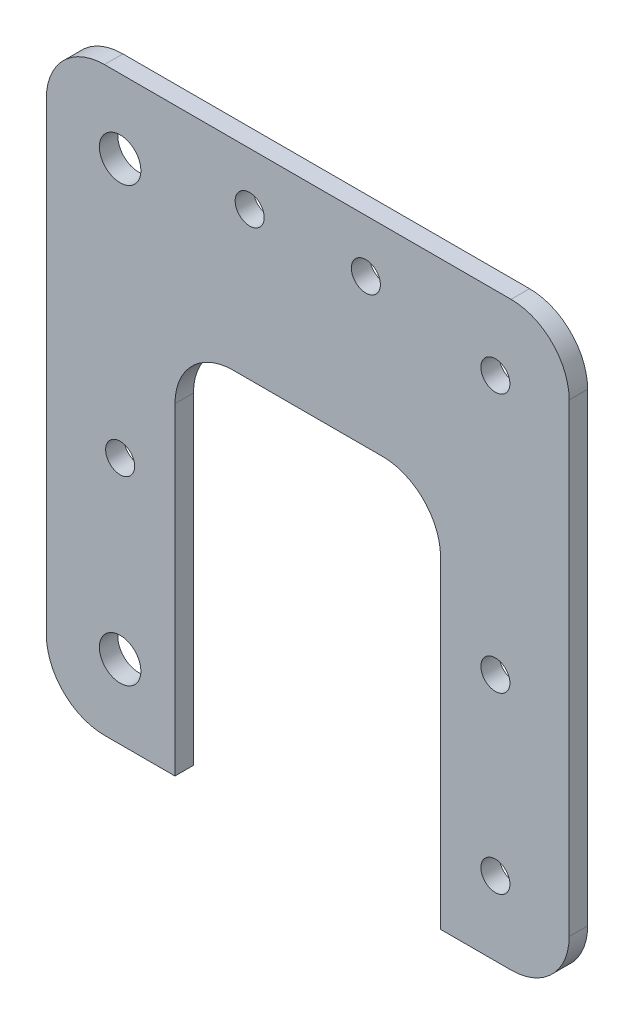
from build123d import *

# Parameters (mm, degrees)
BOSS_EXTRUDE1_START = 19.16
SKETCH1_W           = 90
SKETCH1_H           = 100
SKETCH1_R           = 2.5
SKETCH1_R_2         = 3.57
BOSS_EXTRUDE1_DEPTH = 3.18
SKETCH2_W           = 45.72
SKETCH2_H           = 65.511870912
CUT_EXTRUDE1_DEPTH  = 72.134467033
FILLET1_R           = 10
SKETCH3_R           = 2.5
CUT_EXTRUDE2_DEPTH  = 72.134467033


with BuildPart() as part:
    # Sketch1 → Boss-Extrude1 (new body)
    with BuildSketch(Plane.XY.offset(BOSS_EXTRUDE1_START)):
        with Locations((0, -5)):
            Rectangle(SKETCH1_W, SKETCH1_H)
        with Locations((32.3, -12.3)):
            Circle(SKETCH1_R, mode=Mode.SUBTRACT)
        with Locations((32.3, -42.3)):
            Circle(SKETCH1_R, mode=Mode.SUBTRACT)
        with Locations((-32.3, -42.3)):
            Circle(SKETCH1_R_2, mode=Mode.SUBTRACT)
        with Locations((-32.3, -12.3)):
            Circle(SKETCH1_R, mode=Mode.SUBTRACT)
        with Locations((-32.3, 32.3)):
            Circle(SKETCH1_R_2, mode=Mode.SUBTRACT)
        with Locations((32.3, 32.3)):
            Circle(SKETCH1_R, mode=Mode.SUBTRACT)
    extrude(amount=-BOSS_EXTRUDE1_DEPTH)

    # Sketch2 → Cut-Extrude1 (cut, through all)
    with BuildSketch(Plane(origin=(0, 0, 15.98), x_dir=(-1, 0, 0), z_dir=(0, 0, -1))):
        with Locations((0, -22.244064544)):
            Rectangle(SKETCH2_W, SKETCH2_H)
    extrude(amount=-CUT_EXTRUDE1_DEPTH, mode=Mode.SUBTRACT)

    # Fillet1
    fillet1_edges = [part.edges().sort_by_distance(p)[0] for p in [
        (45, -55, 17.57),
        (-45, -55, 17.57),
        (-45, 45, 17.57),
        (45, 45, 17.57),
        (-22.86, 10.511870912, 17.57),
        (22.86, 10.511870912, 17.57),
    ]]
    fillet(fillet1_edges, radius=FILLET1_R)

    # Sketch3 → Cut-Extrude2 (cut, through all)
    with BuildSketch(Plane.XY.offset(19.16)):
        with Locations((10, 35.930865744)):
            Circle(SKETCH3_R)
        with Locations((-10, 35.930865744)):
            Circle(SKETCH3_R)
    extrude(amount=-CUT_EXTRUDE2_DEPTH, mode=Mode.SUBTRACT)


solid = part.part
